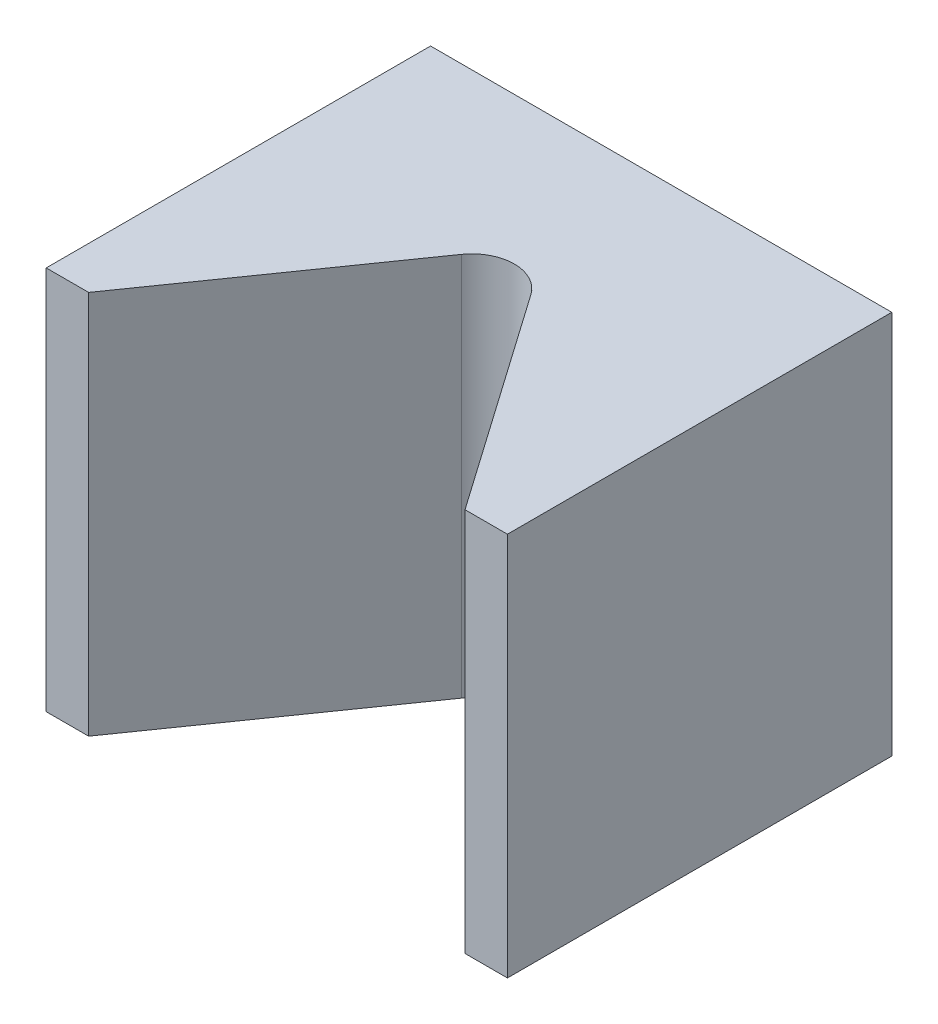
from build123d import *

# Parameters (mm, degrees)
BOSS_EXTRUDE1_DEPTH = 10
SKETCH2_R           = 2.1
CUT_EXTRUDE1_DEPTH  = 2


with BuildPart() as part:
    # Sketch1 → Boss-Extrude1 (new body)
    with BuildSketch(Plane(origin=(0, 0, 0), x_dir=(1, 0, 0), z_dir=(0, 1, 0))):
        with BuildLine():
            Line((0.904649293, 0.632741314), (4.896029025, -5.073854375))
            Line((4.896029025, -5.073854375), (6, -5.073854375))
            Line((6, -5.073854375), (6, 4.926145625))
            Line((6, 4.926145625), (-6, 4.926145625))
            Line((-6, 4.926145625), (-6, -5.073854375))
            Line((-6, -5.073854375), (-4.896029025, -5.073854375))
            Line((-4.896029025, -5.073854375), (-0.904649293, 0.632741314))
            ThreePointArc((-0.904649293, 0.632741314), (0, 1.103970975), (0.904649293, 0.632741314))
        make_face()
    extrude(amount=BOSS_EXTRUDE1_DEPTH)

    # Sketch2 → Cut-Extrude1 (cut)
    with BuildSketch(Plane(origin=(0, 0, -4.926145625), x_dir=(-1, 0, 0), z_dir=(0, 0, -1))):
        with Locations((0, 5)):
            Circle(SKETCH2_R)
    extrude(amount=-CUT_EXTRUDE1_DEPTH, mode=Mode.SUBTRACT)


solid = part.part
